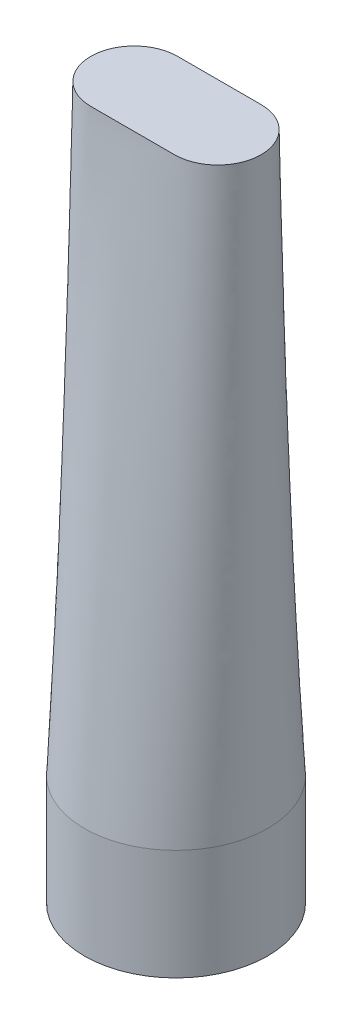
from build123d import *

# Parameters (mm, degrees)
SKETCH1_R           = 33.14
BOSS_EXTRUDE7_DEPTH = 40


with BuildPart() as part:
    # Sketch1 → Boss-Extrude7 (new body)
    with BuildSketch(Plane(origin=(0, 0, 0), x_dir=(1, 0, 0), z_dir=(0, 1, 0))):
        with Locations(Location((0, 0, 0), (0, 0, 270))):
            Circle(SKETCH1_R)
    extrude(amount=BOSS_EXTRUDE7_DEPTH)

    # Sketch2 → Cut-Revolve1 (revolve, cut)
    with BuildSketch(Plane.XY):
        with BuildLine():
            Line((0, 33.14), (0, 0))
            Line((0, 0), (33.14, 0))
            ThreePointArc((33.14, 0), (23.433518729, 23.433518729), (0, 33.14))
        make_face()
    revolve(axis=Axis((0, 33.14, 0), (0, -1, 0)), mode=Mode.SUBTRACT)

    # Loft2: read off the stored shape, not the designer's step
    # Loft2: loft between two sections, ruled curve by curve
    loft2_from = [
        Edge.make_bspline([(11.0271054, 250, 15.693425337), (9.717255887, 250, 15.693425337), (7.200404048, 250, 15.693425337), (3.565186877, 250, 15.693425337), (0, 250, 15.693425337), (-3.565186877, 250, 15.693425337), (-7.200404048, 250, 15.693425337), (-10.975681806, 250, 15.693425337), (-13.698228021, 250, 15.693425337), (-17.01407632, 250, 15.693425337), (-20.883114432, 250, 15.013417832), (-26.17258951, 250, 11.742683375), (-29.298181468, 250, 7.348658434), (-30.607496373, 250, 3.235198337), (-30.945491545, 250, 0), (-30.607496373, 250, -3.235198337), (-29.298181468, 250, -7.348658434), (-26.17258951, 250, -11.742683375), (-20.883114432, 250, -15.013417832), (-17.01407632, 250, -15.693425337), (-13.698228021, 250, -15.693425337), (-10.975681806, 250, -15.693425337), (-7.200404048, 250, -15.693425337), (-3.565186877, 250, -15.693425337), (0, 250, -15.693425337), (3.565186877, 250, -15.693425337), (7.200404048, 250, -15.693425337), (10.975681806, 250, -15.693425337), (13.698228021, 250, -15.693425337), (17.01407632, 250, -15.693425337), (20.883114432, 250, -15.013417832), (26.17258951, 250, -11.742683375), (29.298181468, 250, -7.348658434), (30.607496373, 250, -3.235198337), (30.945491545, 250, 0), (30.607496373, 250, 3.235198337), (29.298181468, 250, 7.348658434), (26.17258951, 250, 11.742683375), (20.883114432, 250, 15.013417832), (17.01407632, 250, 15.693425337), (13.698228021, 250, 15.693425337), (12.336954914, 250, 15.693425337), (11.0271054, 250, 15.693425337)], [0.527157019, 0.527157019, 0.527157019, 0.527157019, 0.554314037, 0.581471056, 0.608628074, 0.635785093, 0.662942111, 0.69009913, 0.717256148, 0.717256148, 0.75259913, 0.787942111, 0.823285093, 0.840956583, 0.858628074, 0.876299565, 0.893971056, 0.929314037, 0.964657019, 1, 1, 1.027157019, 1.054314037, 1.081471056, 1.108628074, 1.135785093, 1.162942111, 1.19009913, 1.217256148, 1.217256148, 1.25259913, 1.287942111, 1.323285093, 1.340956583, 1.358628074, 1.376299565, 1.393971056, 1.429314037, 1.464657019, 1.5, 1.5, 1.527157019, 1.527157019, 1.527157019, 1.527157019], 3),
    ]
    loft2_to = [
        Edge.make_bspline([(18.452921353, 40, 27.527312367), (16.773521911, 40, 28.65292023), (13.094954469, 40, 30.671343614), (6.779019435, 40, 32.671854648), (0, 40, 33.37459225), (-6.779019435, 40, 32.671854648), (-13.094954469, 40, 30.671343614), (-18.612805633, 40, 27.643708538), (-21.651835957, 40, 25.159700469), (-24.773929538, 40, 22.14790483), (-27.776279888, 40, 18.502093583), (-30.896900485, 40, 12.569660246), (-32.428473357, 40, 7.38864691), (-33.038688921, 40, 3.176222121), (-33.190639416, 40, 0), (-33.038688921, 40, -3.176222121), (-32.428473357, 40, -7.38864691), (-30.896900485, 40, -12.569660246), (-27.776279888, 40, -18.502093583), (-24.773929538, 40, -22.14790483), (-21.651835957, 40, -25.159700469), (-18.612805633, 40, -27.643708538), (-13.094954469, 40, -30.671343614), (-6.779019435, 40, -32.671854648), (0, 40, -33.37459225), (6.779019435, 40, -32.671854648), (13.094954469, 40, -30.671343614), (18.612805633, 40, -27.643708538), (21.651835957, 40, -25.159700469), (24.773929538, 40, -22.14790483), (27.776279888, 40, -18.502093583), (30.896900485, 40, -12.569660246), (32.428473357, 40, -7.38864691), (33.038688921, 40, -3.176222121), (33.190639416, 40, 0), (33.038688921, 40, 3.176222121), (32.428473357, 40, 7.38864691), (30.896900485, 40, 12.569660246), (27.776279888, 40, 18.502093583), (24.773929538, 40, 22.14790483), (21.651835957, 40, 25.159700469), (20.132320795, 40, 26.401704504), (18.452921353, 40, 27.527312367)], [0.527157019, 0.527157019, 0.527157019, 0.527157019, 0.554314037, 0.581471056, 0.608628074, 0.635785093, 0.662942111, 0.69009913, 0.717256148, 0.717256148, 0.75259913, 0.787942111, 0.823285093, 0.840956583, 0.858628074, 0.876299565, 0.893971056, 0.929314037, 0.964657019, 1, 1, 1.027157019, 1.054314037, 1.081471056, 1.108628074, 1.135785093, 1.162942111, 1.19009913, 1.217256148, 1.217256148, 1.25259913, 1.287942111, 1.323285093, 1.340956583, 1.358628074, 1.376299565, 1.393971056, 1.429314037, 1.464657019, 1.5, 1.5, 1.527157019, 1.527157019, 1.527157019, 1.527157019], 3),
    ]
    loft2 = Solid(Shell([*[Face.make_surface_from_curves(loft2_from[k], loft2_to[k]) for k in range(1)], Face(Wire(loft2_from)), Face(Wire(loft2_to))]))
    add(loft2)


solid = part.part
